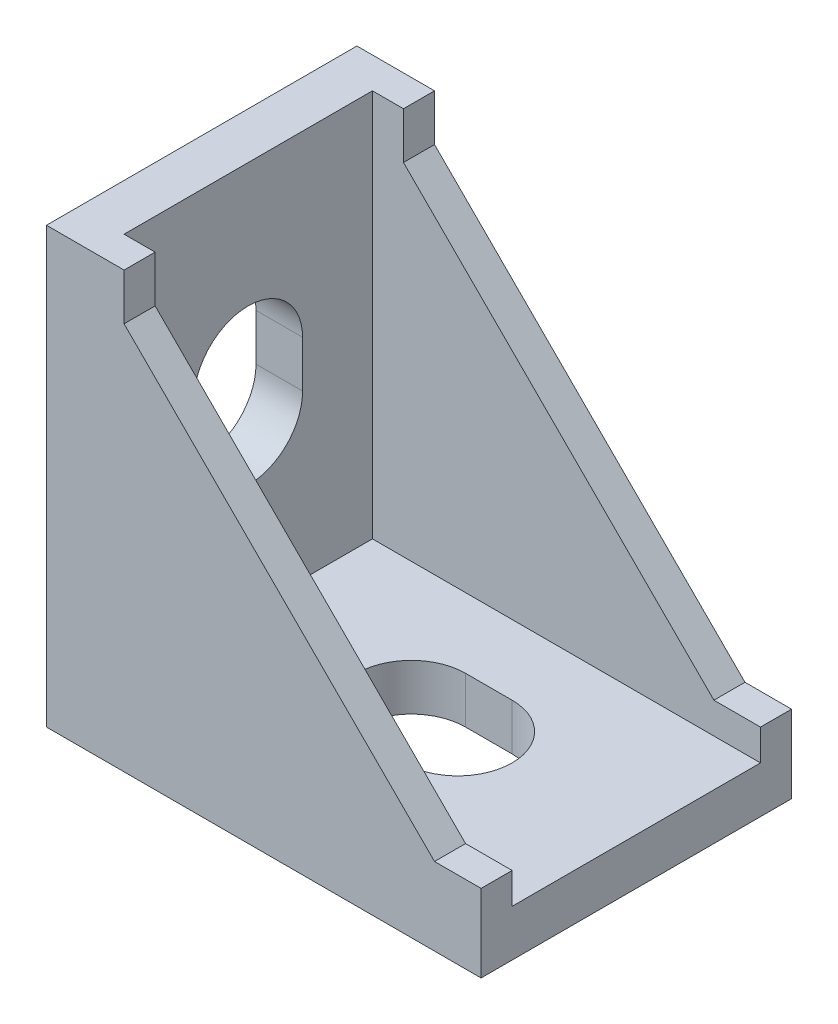
from build123d import *

# Parameters (mm, degrees)
BOSS_EXTRUDE1_DEPTH = 20
CUT_EXTRUDE1_DEPTH  = 10
CUT_EXTRUDE2_DEPTH  = 10
BOSS_EXTRUDE2_DEPTH = 2


with BuildPart() as part:
    # Sketch2 → Boss-Extrude1 (new body)
    with BuildSketch(Plane.XY):
        Polygon((0, 0), (0, 28), (3, 28), (3, 3), (28, 3), (28, 0), align=None)
    extrude(amount=-BOSS_EXTRUDE1_DEPTH)

    # Sketch4 → Cut-Extrude1 (cut)
    with BuildSketch(Plane(origin=(0, 3, 0), x_dir=(1, 0, 0), z_dir=(0, 1, 0))):
        with BuildLine():
            Line((13.5, 13.5), (16.5, 13.5))
            ThreePointArc((16.5, 13.5), (20, 10), (16.5, 6.5))
            Line((16.5, 6.5), (13.5, 6.5))
            ThreePointArc((13.5, 6.5), (10, 10), (13.5, 13.5))
        make_face()
    extrude(amount=-CUT_EXTRUDE1_DEPTH, mode=Mode.SUBTRACT)

    # Sketch5 → Cut-Extrude2 (cut)
    with BuildSketch(Plane(origin=(3, 0, 0), x_dir=(0, 0, -1), z_dir=(1, 0, 0))):
        with BuildLine():
            Line((13.5, 16.5), (13.5, 13.5))
            ThreePointArc((13.5, 13.5), (10, 10), (6.5, 13.5))
            Line((6.5, 13.5), (6.5, 16.5))
            ThreePointArc((6.5, 16.5), (10, 20), (13.5, 16.5))
        make_face()
    extrude(amount=-CUT_EXTRUDE2_DEPTH, mode=Mode.SUBTRACT)

    # Sketch6 → Boss-Extrude2 (add)
    with BuildSketch(Plane.XY):
        Polygon((3, 28), (5, 28), (5, 25), (25, 5), (28, 5), (28, 3), (3, 3), align=None)
    boss_extrude2 = extrude(amount=-BOSS_EXTRUDE2_DEPTH)

    # Mirror4: Boss-Extrude2 across plane
    add(boss_extrude2.mirror(Plane(origin=(0, 0, -10), x_dir=(1, 0, 0), z_dir=(0, 0, -1))))


solid = part.part
